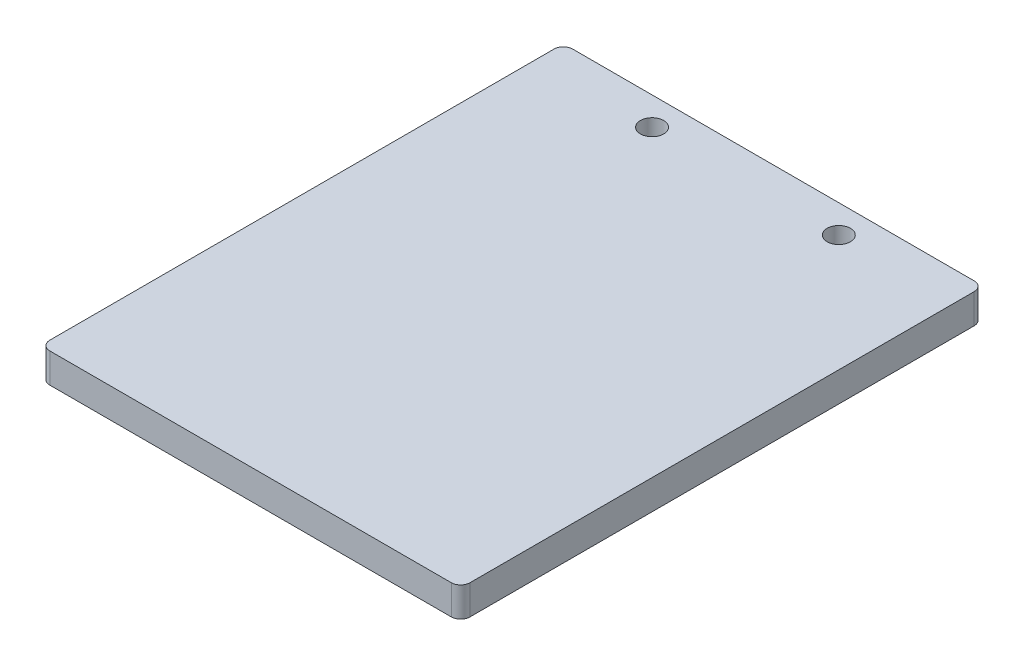
from build123d import *

# Parameters (mm, degrees)
SKETCH1_W             = 45
SKETCH1_H             = 56
SKETCH1_R             = 1.1
BOSS_EXTRUDE1_DEPTH   = 3.175
FILLET1_R             = 1
M3X0_5_TAPPED_HOLE1_D = 2.5


with BuildPart() as part:
    # Sketch1 → Boss-Extrude1 (new body)
    with BuildSketch(Plane(origin=(0, 0, 0), x_dir=(1, 0, 0), z_dir=(0, 1, 0))):
        with Locations((22.5, -28)):
            Rectangle(SKETCH1_W, SKETCH1_H)
        with Locations((12.5, -3)):
            Circle(SKETCH1_R, mode=Mode.SUBTRACT)
        with Locations((32.5, -3)):
            Circle(SKETCH1_R, mode=Mode.SUBTRACT)
    extrude(amount=BOSS_EXTRUDE1_DEPTH)

    # Fillet1
    fillet1_edges = [part.edges().sort_by_distance(p)[0] for p in [
        (0, 1.5875, 56),
        (45, 1.5875, 56),
        (45, 1.5875, 0),
        (0, 1.5875, 0),
    ]]
    fillet(fillet1_edges, radius=FILLET1_R)

    # M3x0.5 Tapped Hole1 (through all)
    with Locations(Plane(origin=(12.5, 3.175, 3), x_dir=(0, 0, 1), z_dir=(0, 1, 0))):
        with Locations((0, 0), (0, 20)):
            Hole(M3X0_5_TAPPED_HOLE1_D / 2)


solid = part.part
